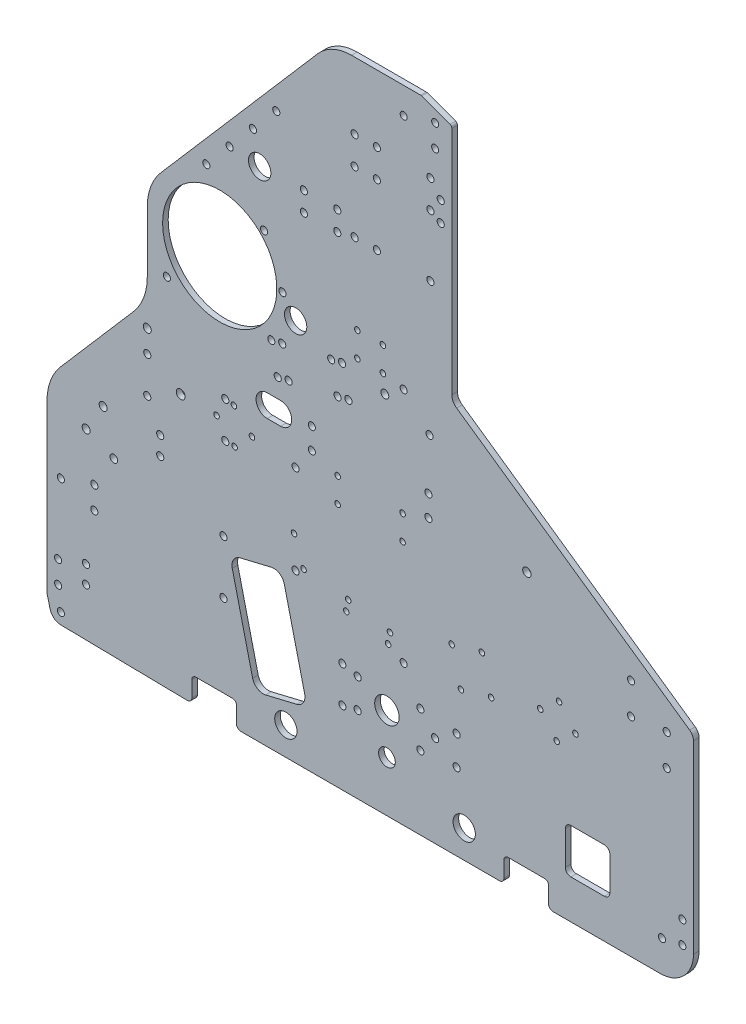
from build123d import *

# Parameters (mm, degrees)
SKETCH1_R           = 2.032
SKETCH1_R_2         = 2.54
SKETCH1_R_3         = 2
BOSS_EXTRUDE1_DEPTH = 3.175
FILLET1_R           = 2.286
FILLET2_R           = 6.35
SKETCH2_R           = 2.032
CUT_EXTRUDE1_DEPTH  = 505.524983177
FILLET3_R           = 1.5875
SKETCH3_R           = 6.35
SKETCH3_R_2         = 2.032
SKETCH3_R_3         = 2.286
CUT_EXTRUDE2_DEPTH  = 505.524983177
SKETCH4_R           = 2.032
SKETCH4_R_2         = 6.985
SKETCH4_R_3         = 4.7625
CUT_EXTRUDE3_DEPTH  = 505.524983177
SKETCH5_R           = 32.54375
SKETCH5_R_2         = 6.35
SKETCH5_R_3         = 2.39
CUT_EXTRUDE5_DEPTH  = 505.524983177
FILLET4_R           = 31.75
CUT_EXTRUDE6_DEPTH  = 505.524983177
FILLET5_R           = 25.4
SKETCH8_R           = 2.032000002
SKETCH8_R_2         = 2.031999999
SKETCH8_R_3         = 2.031999998
CUT_EXTRUDE7_DEPTH  = 505.524983177
SKETCH10_R          = 2.032
CUT_EXTRUDE8_DEPTH  = 505.524983177
SKETCH11_RX         = 2.032
SKETCH11_RY         = 2.031999502
CUT_EXTRUDE9_DEPTH  = 505.524983177
SKETCH12_R          = 2.032
CUT_EXTRUDE10_DEPTH = 505.524983319
SKETCH14_R          = 6.375981846
CUT_EXTRUDE11_DEPTH = 505.524983319
SKETCH15_R          = 2.286
SKETCH15_R_2        = 2.159
CUT_EXTRUDE12_DEPTH = 505.524983319
FILLET7_R           = 5.08
FILLET8_R           = 2.54
SKETCH17_R          = 2.032
CUT_EXTRUDE13_DEPTH = 505.524983319
FILLET9_R           = 19.05
SKETCH18_R          = 1.5875
CUT_EXTRUDE14_DEPTH = 505.524983319


with BuildPart() as part:
    # Sketch1 → Boss-Extrude1 (new body)
    with BuildSketch(Plane.XY):
        with BuildLine():
            Line((7.829508682, -19.049081656), (82.55, -20.32))
            Line((82.55, -20.32), (82.55, -6.35))
            Line((82.55, -6.35), (107.95, -6.35))
            Line((107.95, -6.35), (107.95, -20.32))
            Line((107.95, -20.32), (260.35, -20.32))
            Line((260.35, -20.32), (260.35, -6.35))
            Line((260.35, -6.35), (285.75, -6.35))
            Line((285.75, -6.35), (285.75, -20.32))
            Line((285.75, -20.32), (368.3, -20.32))
            Line((368.3, -20.32), (368.3, 106.68))
            Line((368.3, 106.68), (230.66375, 202.565))
            Line((230.66375, 202.565), (230.66375, 338.455))
            Line((230.66375, 338.455), (213.19998, 344.805))
            Line((213.19998, 344.805), (203.2, 344.805))
            Line((203.2, 344.805), (161.925, 344.805))
            Line((161.925, 344.805), (52.720122664, 218.469945827))
            ThreePointArc((52.720122664, 218.469945827), (52.803835479, 218.142145922), (52.832, 217.805))
            ThreePointArc((52.832, 217.805), (52.095493096, 216.239521914), (50.419872403, 215.808871996))
            Line((50.419872403, 215.808871996), (0, 157.48))
            Line((0, 157.48), (0, 0))
            Line((0, 0), (0, -6.35))
            ThreePointArc((0, -6.35), (0.047577015, -7.125863724), (0.189595124, -7.890101219))
            Line((0.189595124, -7.890101219), (1.777095124, -14.240101219))
            ThreePointArc((1.777095124, -14.240101219), (3.987212552, -17.671692778), (7.829508682, -19.049081656))
        make_face()
        with Locations((7.9375, -12.7)):
            Circle(SKETCH1_R, mode=Mode.SUBTRACT)
        with Locations((6.35, 0)):
            Circle(SKETCH1_R, mode=Mode.SUBTRACT)
        with Locations((6.35, 12.7)):
            Circle(SKETCH1_R, mode=Mode.SUBTRACT)
        with Locations((38.1, 78.105)):
            Circle(SKETCH1_R, mode=Mode.SUBTRACT)
        with Locations((57.15, 118.58625)):
            Circle(SKETCH1_R, mode=Mode.SUBTRACT)
        with Locations((57.15, 139.22375)):
            Circle(SKETCH1_R, mode=Mode.SUBTRACT)
        with Locations((76.2, 128.905)):
            Circle(SKETCH1_R_2, mode=Mode.SUBTRACT)
        with Locations((101.6, 118.58625)):
            Circle(SKETCH1_R, mode=Mode.SUBTRACT)
        with Locations((101.6, 139.22375)):
            Circle(SKETCH1_R, mode=Mode.SUBTRACT)
        with BuildLine():
            ThreePointArc((125.468192568, 141.56106164), (119.118192568, 147.91106164), (125.468192568, 154.26106164))
            Line((125.468192568, 154.26106164), (133.088192568, 154.26106164))
            ThreePointArc((133.088192568, 154.26106164), (139.438192568, 147.91106164), (133.088192568, 141.56106164))
            Line((133.088192568, 141.56106164), (125.468192568, 141.56106164))
        make_face(mode=Mode.SUBTRACT)
        with Locations((203.2, 59.805)):
            Circle(SKETCH1_R_3, mode=Mode.SUBTRACT)
        with Locations((350.339487758, -2.359487758)):
            Circle(SKETCH1_R, mode=Mode.SUBTRACT)
        with Locations((361.95, 0)):
            Circle(SKETCH1_R, mode=Mode.SUBTRACT)
        with Locations((361.95, 12.7)):
            Circle(SKETCH1_R, mode=Mode.SUBTRACT)
        with Locations((353.06, 82.955052336)):
            Circle(SKETCH1_R, mode=Mode.SUBTRACT)
        with Locations((332.74, 98.195052336)):
            Circle(SKETCH1_R, mode=Mode.SUBTRACT)
        with Locations((332.74, 115.975052336)):
            Circle(SKETCH1_R, mode=Mode.SUBTRACT)
        with Locations((353.06, 100.735052336)):
            Circle(SKETCH1_R, mode=Mode.SUBTRACT)
        with Locations((68.326, 182.923674932)):
            Circle(SKETCH1_R, mode=Mode.SUBTRACT)
        with Locations((76.2, 217.805)):
            Circle(SKETCH1_R, mode=Mode.SUBTRACT)
        with Locations((90.779500502, 249.682)):
            Circle(SKETCH1_R, mode=Mode.SUBTRACT)
        with Locations((104.067838673, 265.054783374)):
            Circle(SKETCH1_R, mode=Mode.SUBTRACT)
        with Locations((117.356176844, 280.427566748)):
            Circle(SKETCH1_R, mode=Mode.SUBTRACT)
        with Locations((130.644515014, 295.800350122)):
            Circle(SKETCH1_R, mode=Mode.SUBTRACT)
        with Locations((203.2, 194.805)):
            Circle(SKETCH1_R_3, mode=Mode.SUBTRACT)
        with Locations((224.31375, 287.401)):
            Circle(SKETCH1_R, mode=Mode.SUBTRACT)
        with Locations((224.31375, 298.831)):
            Circle(SKETCH1_R, mode=Mode.SUBTRACT)
        with Locations((203.2, 329.805)):
            Circle(SKETCH1_R_3, mode=Mode.SUBTRACT)
        with Locations((221.138115, 322.58)):
            Circle(SKETCH1_R_3, mode=Mode.SUBTRACT)
        with Locations((221.138115, 335.28)):
            Circle(SKETCH1_R_3, mode=Mode.SUBTRACT)
    extrude(amount=BOSS_EXTRUDE1_DEPTH)

    # Fillet1
    fillet1_edges = [part.edges().sort_by_distance(p)[0] for p in [
        (285.75, -6.35, 1.5875),
        (107.95, -6.35, 1.5875),
        (260.35, -6.35, 1.5875),
        (82.55, -6.35, 1.5875),
    ]]
    fillet(fillet1_edges, radius=FILLET1_R)

    # Fillet2
    fillet2_edges = [part.edges().sort_by_distance(p)[0] for p in [
        (230.66375, 202.565, 1.5875),
    ]]
    fillet(fillet2_edges, radius=FILLET2_R)

    # Sketch2 → Cut-Extrude1 (cut, through all)
    with BuildSketch(Plane(origin=(0, 0, 0), x_dir=(-1, 0, 0), z_dir=(0, 0, -1))):
        with Locations((-100.552770272, 71.086035298)):
            Circle(SKETCH2_R)
        with Locations((-100.552770272, 40.606035298)):
            Circle(SKETCH2_R)
        with Locations((-22.225, 18.202541089)):
            Circle(SKETCH2_R)
        with Locations((-22.225, 8.042541089)):
            Circle(SKETCH2_R)
    extrude(amount=-CUT_EXTRUDE1_DEPTH, mode=Mode.SUBTRACT)

    # Fillet3
    fillet3_edges = [part.edges().sort_by_distance(p)[0] for p in [
        (230.66375, 338.455, 1.5875),
        (213.19998, 344.805, 1.5875),
    ]]
    fillet(fillet3_edges, radius=FILLET3_R)

    # Sketch3 → Cut-Extrude2 (cut, through all)
    with BuildSketch(Plane.XY.offset(3.175)):
        with BuildLine():
            Line((127.789350211, 69.359774106), (110.090750339, 65.117184968))
            ThreePointArc((110.090750339, 65.117184968), (106.287939856, 62.356288953), (105.55119507, 57.715047577))
            Line((105.55119507, 57.715047577), (117.160037875, 9.287010566))
            ThreePointArc((117.160037875, 9.287010566), (119.92093389, 5.484200083), (124.562175266, 4.747455297))
            Line((124.562175266, 4.747455297), (142.260775137, 8.990044434))
            ThreePointArc((142.260775137, 8.990044434), (146.063585621, 11.75094045), (146.800330407, 16.392181825))
            Line((146.800330407, 16.392181825), (135.191487602, 64.820218836))
            ThreePointArc((135.191487602, 64.820218836), (132.430591586, 68.62302932), (127.789350211, 69.359774106))
        make_face()
        with Locations((136.094563167, -4.324155877)):
            Circle(SKETCH3_R)
        with Locations((237.694563167, -4.324155877)):
            Circle(SKETCH3_R)
        with Locations((26.987500002, 46.953113935)):
            Circle(SKETCH3_R_2)
        with Locations((26.987500002, 59.653113935)):
            Circle(SKETCH3_R_2)
        with Locations((7.937500002, 53.303113935)):
            Circle(SKETCH3_R_2)
        with Locations((32.030600949, 100.810868853)):
            Circle(SKETCH3_R_3)
        with Locations((64.525942114, 102.94048958)):
            Circle(SKETCH3_R_2)
        with Locations((64.525942114, 92.525786339)):
            Circle(SKETCH3_R_2)
        with Locations((134.14375, 208.228121768)):
            Circle(SKETCH3_R_2)
        with Locations((123.681970341, 233.485092108)):
            Circle(SKETCH3_R_2)
    extrude(amount=-CUT_EXTRUDE2_DEPTH, mode=Mode.SUBTRACT)

    # Sketch4 → Cut-Extrude3 (cut, through all)
    with BuildSketch(Plane.XY.offset(3.175)):
        with Locations((168.275, 42.06875)):
            Circle(SKETCH4_R)
        with Locations((212.725, 42.06875)):
            Circle(SKETCH4_R)
        with Locations((212.725, 21.43125)):
            Circle(SKETCH4_R)
        with Locations((168.275, 21.43125)):
            Circle(SKETCH4_R)
        with Locations((193.675, 31.75)):
            Circle(SKETCH4_R_2)
        with Locations((177.00498, 40.0431)):
            Circle(SKETCH4_R)
        with Locations((177.00498, 23.4569)):
            Circle(SKETCH4_R)
        with Locations((193.675, 8.466666658)):
            Circle(SKETCH4_R_3)
        with Locations((221.138115, 31.75)):
            Circle(SKETCH4_R)
        with Locations((233.36123, 23.4569)):
            Circle(SKETCH4_R)
        with Locations((233.36123, 40.0431)):
            Circle(SKETCH4_R)
    extrude(amount=-CUT_EXTRUDE3_DEPTH, mode=Mode.SUBTRACT)

    # Sketch5 → Cut-Extrude5 (cut, through all)
    with BuildSketch(Plane(origin=(0, 0, 0), x_dir=(-1, 0, 0), z_dir=(0, 0, -1))):
        Polygon((0, 157.48), (-57.15, 223.594705882), (-57.15, 165.333696112), (0, 99.218990229), align=None)
        with Locations((-98.425, 208.228121768)):
            Circle(SKETCH5_R)
        with Locations((-141.675587431, 197.971943782)):
            Circle(SKETCH5_R_2)
        with Locations((-273.4056, 139.72794)):
            Circle(SKETCH5_R_3)
    extrude(amount=-CUT_EXTRUDE5_DEPTH, mode=Mode.SUBTRACT)

    # Fillet4
    fillet4_edges = [part.edges().sort_by_distance(p)[0] for p in [
        (0, 99.218990229, 1.5875),
        (57.15, 165.333696112, 1.5875),
        (57.15, 223.594705882, 1.5875),
    ]]
    fillet(fillet4_edges, radius=FILLET4_R)

    # Sketch6 → Cut-Extrude6 (cut, through all)
    with BuildSketch(Plane.XY.offset(3.175)):
        with BuildLine():
            Line((298.45, 27.305), (317.5, 27.305))
            ThreePointArc((317.5, 27.305), (319.74506403, 26.37506403), (320.675, 24.13))
            Line((320.675, 24.13), (320.675, 5.08))
            ThreePointArc((320.675, 5.08), (319.74506403, 2.83493597), (317.5, 1.905))
            Line((317.5, 1.905), (298.45, 1.905))
            ThreePointArc((298.45, 1.905), (296.20493597, 2.83493597), (295.275, 5.08))
            Line((295.275, 5.08), (295.275, 24.13))
            ThreePointArc((295.275, 24.13), (296.20493597, 26.37506403), (298.45, 27.305))
        make_face()
    extrude(amount=-CUT_EXTRUDE6_DEPTH, mode=Mode.SUBTRACT)

    # Fillet5
    fillet5_edges = [part.edges().sort_by_distance(p)[0] for p in [
        (161.925, 344.805, 1.5875),
    ]]
    fillet(fillet5_edges, radius=FILLET5_R)

    # Sketch8 → Cut-Extrude7 (cut, through all)
    with BuildSketch(Plane(origin=(0, 0, 0), x_dir=(-1, 0, 0), z_dir=(0, 0, -1))):
        with Locations((-218.44, 290.83)):
            Circle(SKETCH8_R)
        with Locations((-187.96, 290.83)):
            Circle(SKETCH8_R)
        with Locations((-187.96, 306.70500001)):
            Circle(SKETCH8_R_2)
        with Locations((-175.26, 290.83)):
            Circle(SKETCH8_R)
        with Locations((-187.96, 255.905)):
            Circle(SKETCH8_R)
        with Locations((-218.44, 306.70500001)):
            Circle(SKETCH8_R_3)
        with Locations((-175.26, 306.70500001)):
            Circle(SKETCH8_R_2)
        with Locations((-175.26, 255.905)):
            Circle(SKETCH8_R)
        with Locations((-218.44, 255.905)):
            Circle(SKETCH8_R)
    extrude(amount=-CUT_EXTRUDE7_DEPTH, mode=Mode.SUBTRACT)

    # Sketch10 → Cut-Extrude8 (cut, through all)
    with BuildSketch(Plane.XY.offset(3.175)):
        with Locations((141.64248, 74.684371768)):
            Circle(SKETCH10_R)
        with Locations((141.64248, 125.484371768)):
            Circle(SKETCH10_R)
    extrude(amount=-CUT_EXTRUDE8_DEPTH, mode=Mode.SUBTRACT)

    # Sketch11 → Cut-Extrude9 (cut, through all)
    with BuildSketch(Plane.XY.offset(3.175)):
        with Locations(Location((150.881424454, 138.43), (0, 0, 90))):
            Ellipse(SKETCH11_RX, SKETCH11_RY)
        with Locations(Location((150.881424454, 150.495), (0, 0, 90))):
            Ellipse(SKETCH11_RX, SKETCH11_RY)
        with Locations(Location((217.30240818, 150.495), (0, 0, 90))):
            Ellipse(SKETCH11_RX, SKETCH11_RY)
        with Locations(Location((217.30240818, 138.43), (0, 0, 90))):
            Ellipse(SKETCH11_RX, SKETCH11_RY)
    extrude(amount=-CUT_EXTRUDE9_DEPTH, mode=Mode.SUBTRACT)

    # Sketch12 → Cut-Extrude10 (cut, through all)
    with BuildSketch(Plane(origin=(0, 0, 0), x_dir=(-1, 0, 0), z_dir=(0, 0, -1))):
        with Locations((-165.4175, 264.63498)):
            Circle(SKETCH12_R)
        with Locations((-165.4175, 253.52248)):
            Circle(SKETCH12_R)
        with Locations((-146.3675, 253.52248)):
            Circle(SKETCH12_R)
        with Locations((-146.3675, 264.63498)):
            Circle(SKETCH12_R)
    extrude(amount=-CUT_EXTRUDE10_DEPTH, mode=Mode.SUBTRACT)

    # Sketch14 → Cut-Extrude11 (cut, through all)
    with BuildSketch(Plane(origin=(0, 0, 0), x_dir=(-1, 0, 0), z_dir=(0, 0, -1))):
        with Locations((-121.184716432, 263.688494682)):
            Circle(SKETCH14_R)
    extrude(amount=-CUT_EXTRUDE11_DEPTH, mode=Mode.SUBTRACT)

    # Sketch15 → Cut-Extrude12 (cut, through all)
    with BuildSketch(Plane.XY.offset(3.175)):
        with Locations((57.1500001, 151.92375)):
            Circle(SKETCH15_R)
        with Locations((192.439039056, 187.119947783)):
            Circle(SKETCH15_R)
        with Locations((38.0999999, 78.105)):
            Circle(SKETCH15_R_2)
        with Locations((22.35944743, 84.872674248)):
            Circle(SKETCH15_R)
        with BuildLine():
            ThreePointArc((163.873739817, 173.680575348), (163.573171587, 172.102507308), (164.512499286, 170.799317578))
            ThreePointArc((164.512499286, 170.799317578), (167.54083856, 172.982117899), (163.873739817, 173.680575348))
        make_face()
        with BuildLine():
            ThreePointArc((173.439749975, 172.778441407), (173.740318205, 174.356509448), (172.800990506, 175.659699178))
            ThreePointArc((172.800990506, 175.659699178), (169.772651232, 173.476898857), (173.439749975, 172.778441407))
        make_face()
        with BuildLine():
            ThreePointArc((169.158852902, 192.088320238), (166.130513629, 189.905519916), (169.797612372, 189.207062467))
            ThreePointArc((169.797612372, 189.207062467), (170.098180602, 190.785130507), (169.158852902, 192.088320238))
        make_face()
        with BuildLine():
            ThreePointArc((160.231602213, 190.109196408), (159.931033983, 188.531128368), (160.870361683, 187.227938637))
            ThreePointArc((160.870361683, 187.227938637), (163.898700956, 189.410738959), (160.231602213, 190.109196408))
        make_face()
        with BuildLine():
            ThreePointArc((129.776601768, 166.121421831), (129.476033538, 164.543353791), (130.415361238, 163.240164061))
            ThreePointArc((130.415361238, 163.240164061), (133.443700511, 165.422964382), (129.776601768, 166.121421831))
        make_face()
        with BuildLine():
            ThreePointArc((139.342611927, 165.219287891), (139.643180156, 166.797355931), (138.703852457, 168.100545661))
            ThreePointArc((138.703852457, 168.100545661), (135.675513184, 165.91774534), (139.342611927, 165.219287891))
        make_face()
        with BuildLine():
            ThreePointArc((135.700474323, 181.64790895), (136.001042553, 183.225976991), (135.061714854, 184.529166721))
            ThreePointArc((135.061714854, 184.529166721), (132.03337558, 182.3463664), (135.700474323, 181.64790895))
        make_face()
        with BuildLine():
            ThreePointArc((126.134464165, 182.550042891), (125.833895935, 180.971974851), (126.773223634, 179.668785121))
            ThreePointArc((126.773223634, 179.668785121), (129.801562908, 181.851585442), (126.134464165, 182.550042891))
        make_face()
    extrude(amount=-CUT_EXTRUDE12_DEPTH, mode=Mode.SUBTRACT)

    # Fillet7
    fillet7_edges = [part.edges().sort_by_distance(p)[0] for p in [
        (368.3, 106.68, 1.5875),
    ]]
    fillet(fillet7_edges, radius=FILLET7_R)

    # Fillet8
    fillet8_edges = [part.edges().sort_by_distance(p)[0] for p in [
        (82.55, -20.32, 1.5875),
        (107.95, -20.32, 1.5875),
        (260.35, -20.32, 1.5875),
        (285.75, -20.32, 1.5875),
    ]]
    fillet(fillet8_edges, radius=FILLET8_R)

    # Sketch17 → Cut-Extrude13 (cut, through all)
    with BuildSketch(Plane.XY.offset(3.175)):
        with Locations((217.96375, 179.705)):
            Circle(SKETCH17_R)
    extrude(amount=-CUT_EXTRUDE13_DEPTH, mode=Mode.SUBTRACT)

    # Fillet9
    fillet9_edges = [part.edges().sort_by_distance(p)[0] for p in [
        (368.3, -20.32, 1.5875),
    ]]
    fillet(fillet9_edges, radius=FILLET9_R)

    # Sketch18 → Cut-Extrude14 (cut, through all)
    with BuildSketch(Plane.XY.offset(3.175)):
        with Locations((170.511046361, 68.966397639)):
            Circle(SKETCH18_R)
        with Locations((165.591916317, 119.38)):
            Circle(SKETCH18_R)
        with Locations((202.591916317, 119.38)):
            Circle(SKETCH18_R)
        with Locations((176.814816317, 210.82)):
            Circle(SKETCH18_R)
        with Locations((191.369016317, 210.82)):
            Circle(SKETCH18_R)
        with Locations((165.591916317, 133.35)):
            Circle(SKETCH18_R)
        with Locations((202.591916317, 133.35)):
            Circle(SKETCH18_R)
        with Locations((235.829835721, 63.104098689)):
            Circle(SKETCH18_R)
        with Locations((253.003996913, 67.705901311)):
            Circle(SKETCH18_R)
        with Locations((230.570632725, 82.731711479)):
            Circle(SKETCH18_R)
        with Locations((247.744793916, 87.333514101)):
            Circle(SKETCH18_R)
        with Locations((140.737131429, 92.548810178)):
            Circle(SKETCH18_R)
        with Locations((146.166701205, 77.631189823)):
            Circle(SKETCH18_R)
        with Locations((116.781916317, 128.27)):
            Circle(SKETCH18_R)
        with Locations((106.490542802, 138.561373515)):
            Circle(SKETCH18_R)
        with Locations((281.014286603, 76.059582017)):
            Circle(SKETCH18_R)
        with Locations((290.369546031, 64.910417983)):
            Circle(SKETCH18_R)
        with Locations((96.612261069, 128.683091782)):
            Circle(SKETCH18_R)
        with Locations((106.903634584, 118.391718267)):
            Circle(SKETCH18_R)
        with Locations((176.814816317, 196.85)):
            Circle(SKETCH18_R)
        with Locations((191.369016317, 196.85)):
            Circle(SKETCH18_R)
        with Locations((291.715927473, 85.039324924)):
            Circle(SKETCH18_R)
        with Locations((301.071186902, 73.89016089)):
            Circle(SKETCH18_R)
        with Locations((194.31, 64.77)):
            Circle(SKETCH18_R)
        with Locations((171.613712289, 75.219926871)):
            Circle(SKETCH18_R)
        with Locations((195.412665928, 71.023529232)):
            Circle(SKETCH18_R)
    extrude(amount=-CUT_EXTRUDE14_DEPTH, mode=Mode.SUBTRACT)


solid = part.part
